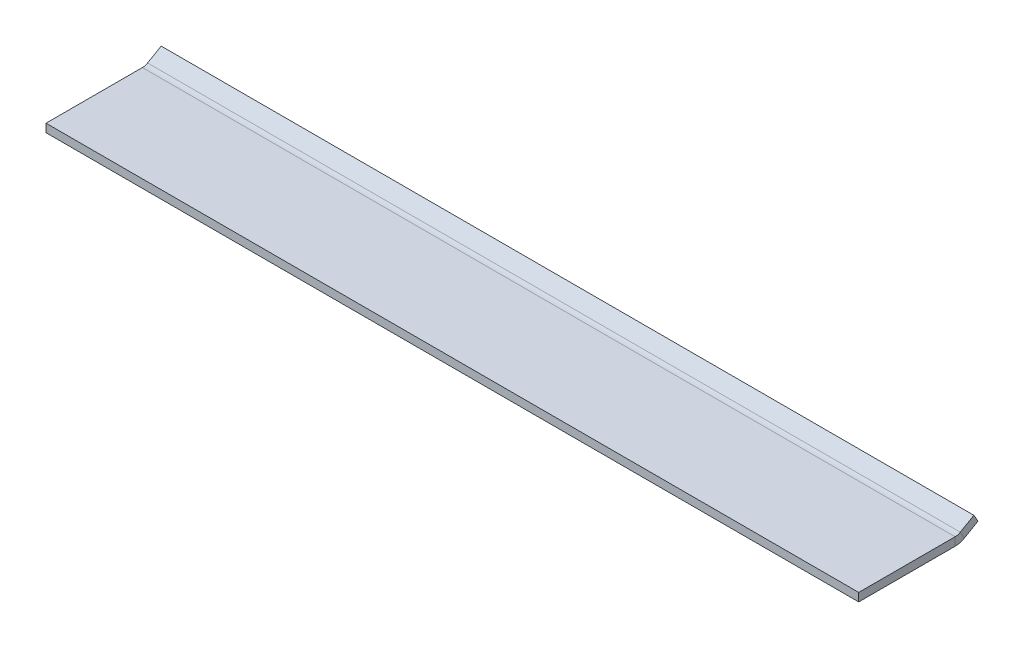
from build123d import *

# Parameters (mm, degrees)
SKETCH1_W            = 1180
SKETCH1_H            = 168
BASE_FLANGE1_DEPTH   = 12
EDGE_FLANGE1_START   = -590
EDGE_FLANGE1_DEPTH   = 1180
EDGE_FLANGE1_2_DEPTH = 1180


# Read off the part's stored shape, not the designer's step: Edge-Flange1
# Sheet-metal steps are written as plain solids
with BuildPart() as part:
    # Sketch1 → Base-Flange1 (new body)
    with BuildSketch(Plane(origin=(0, 0, 0), x_dir=(1, 0, 0), z_dir=(0, 1, 0))):
        Rectangle(SKETCH1_W, SKETCH1_H)
    extrude(amount=-BASE_FLANGE1_DEPTH)

    # Edge-Flange1 outline → Edge-Flange1 (cut)
    with BuildSketch(Plane.YZ.offset(EDGE_FLANGE1_START)):
        with BuildLine():
            Line((0, -84), (-8.382685902, -69.480762114))
            ThreePointArc((-8.382685902, -69.480762114), (-11.07999731, -62.968876332), (-12, -55.980762114))
            Line((-12, -55.980762114), (-12, -84))
            Line((-12, -84), (0, -84))
        make_face()
    extrude(amount=EDGE_FLANGE1_DEPTH, mode=Mode.SUBTRACT)

    # Edge-Flange1 2 outline → Edge-Flange1 2 (add)
    with BuildSketch(Plane.YZ.offset(EDGE_FLANGE1_START)):
        with BuildLine():
            Line((0, -55.980762114), (0, -84))
            Line((0, -84), (3, -89.196152423))
            Line((3, -89.196152423), (13.392304845, -83.196152423))
            Line((13.392304845, -83.196152423), (2.009618943, -63.480762114))
            ThreePointArc((2.009618943, -63.480762114), (0.511112606, -59.86304779), (0, -55.980762114))
        make_face()
    extrude(amount=EDGE_FLANGE1_2_DEPTH)


solid = part.part
